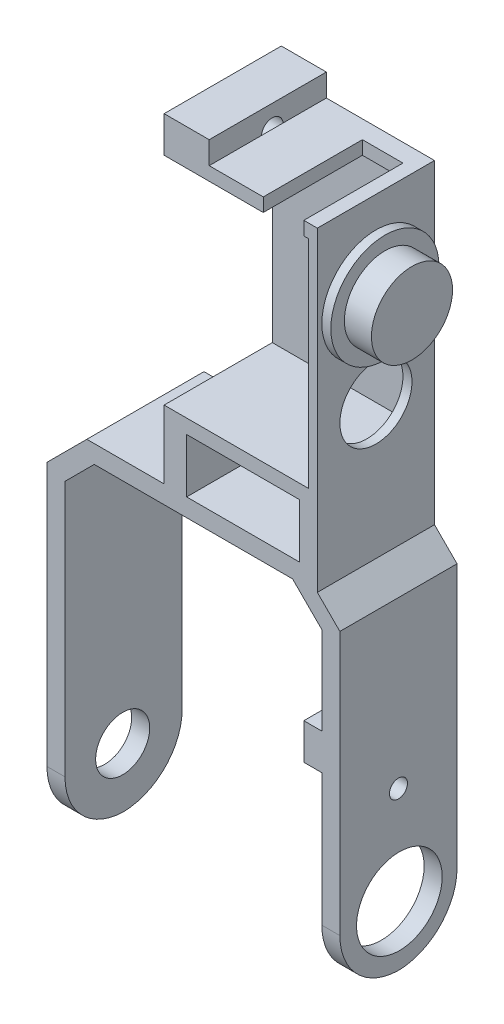
from build123d import *

# Parameters (mm, degrees)
BOSS_EXTRUDE1_DEPTH = 65
BOSS_EXTRUDE2_DEPTH = 65
SKETCH3_W           = 62.5
SKETCH3_H           = 30
CUT_EXTRUDE1_DEPTH  = 65
SKETCH5_W           = 80
SKETCH5_H           = 120
CUT_EXTRUDE2_DEPTH  = 60
SKETCH6_R           = 6
CUT_EXTRUDE3_DEPTH  = 25
FILLET1_R           = 33
SKETCH7_R           = 15
CUT_EXTRUDE4_DEPTH  = 10
SKETCH8_R           = 23.75
CUT_EXTRUDE5_DEPTH  = 10
SKETCH10_W          = 22.5
SKETCH10_H          = 55
CUT_EXTRUDE7_DEPTH  = 25
SKETCH11_R          = 20
CUT_EXTRUDE8_DEPTH  = 5
SKETCH12_R          = 30
BOSS_EXTRUDE3_DEPTH = 5
SKETCH13_R          = 22.5
BOSS_EXTRUDE4_DEPTH = 15
SKETCH14_W          = 10
SKETCH14_H          = 20
BOSS_EXTRUDE5_DEPTH = 65
SKETCH15_R          = 5
CUT_EXTRUDE9_DEPTH  = 10


with BuildPart() as part:
    # Sketch1 → Boss-Extrude1 (new body)
    with BuildSketch(Plane.XY):
        Polygon((-59.142135624, 0), (59.142135624, 0), (81.25, -22.107864376), (81.25, -201.25), (71.25, -201.25), (71.25, -26.25), (55, -10), (-55, -10), (-71.25, -26.25), (-71.25, -201.25), (-81.25, -201.25), (-81.25, -22.107864376), align=None)
    extrude(amount=BOSS_EXTRUDE1_DEPTH)

    # Sketch2 → Boss-Extrude2 (add)
    with BuildSketch(Plane.XY):
        Polygon((68.75, -9.607864376), (68.75, 165.392135624), (8.75, 165.392135624), (8.75, 177.892135624), (-16.25, 177.892135624), (-16.25, 0), (59.142135624, 0), align=None)
    extrude(amount=BOSS_EXTRUDE2_DEPTH)

    # Sketch3 → Cut-Extrude1 (cut)
    with BuildSketch(Plane.XY.offset(65)):
        with Locations((27.5, 15)):
            Rectangle(SKETCH3_W, SKETCH3_H)
    extrude(amount=-CUT_EXTRUDE1_DEPTH, mode=Mode.SUBTRACT)

    # Sketch5 → Cut-Extrude2 (cut)
    with BuildSketch(Plane.XY.offset(65)):
        with Locations((23.75, 97.892135624)):
            Rectangle(SKETCH5_W, SKETCH5_H)
    extrude(amount=-CUT_EXTRUDE2_DEPTH, mode=Mode.SUBTRACT)

    # Sketch6 → Cut-Extrude3 (cut)
    with BuildSketch(Plane.ZY.offset(16.25)):
        with Locations(Location((30, 164.892135624, 0), (0, 0, 270))):
            Circle(SKETCH6_R)
        with Locations(Location((30, 29.942135624, 0), (0, 0, 179.447427343))):
            Circle(SKETCH6_R)
    extrude(amount=-CUT_EXTRUDE3_DEPTH, mode=Mode.SUBTRACT)

    # Fillet1
    # the kernel refuses this fillet: 33 mm, written as the material it takes off along each edge
    with BuildSketch(Plane(origin=(163.75, -201.25, 65), x_dir=(0, 1, 0), z_dir=(-1, 0, 0)), Plane(origin=(11.25, -201.25, 65), x_dir=(0, 1, 0), z_dir=(-1, 0, 0))) as fillet1_piece_1:
        with BuildLine():
            CenterArc((FILLET1_R, FILLET1_R), FILLET1_R, 180, 90)
            Line((0, FILLET1_R), (0, 0))
            Line((0, 0), (FILLET1_R, 0))
        make_face()
    extrude(amount=175, mode=Mode.SUBTRACT)
    with BuildSketch(Plane(origin=(163.75, -201.25, 0), x_dir=(0, 1, 0), z_dir=(-1, 0, 0)), Plane(origin=(11.25, -201.25, 0), x_dir=(0, 1, 0), z_dir=(-1, 0, 0))) as fillet1_piece_2:
        with BuildLine():
            CenterArc((FILLET1_R, -FILLET1_R), FILLET1_R, 90, 90)
            Line((0, -FILLET1_R), (0, 0))
            Line((0, 0), (FILLET1_R, 0))
        make_face()
    extrude(amount=175, mode=Mode.SUBTRACT)

    # Sketch7 → Cut-Extrude4 (cut)
    with BuildSketch(Plane.ZY.offset(81.25)):
        with Locations((33, -168.25)):
            Circle(SKETCH7_R)
    extrude(amount=-CUT_EXTRUDE4_DEPTH, mode=Mode.SUBTRACT)

    # Sketch8 → Cut-Extrude5 (cut)
    with BuildSketch(Plane(origin=(81.25, 0, 0), x_dir=(0, 0, -1), z_dir=(1, 0, 0))):
        with Locations((-32, -168.25)):
            Circle(SKETCH8_R)
    extrude(amount=-CUT_EXTRUDE5_DEPTH, mode=Mode.SUBTRACT)

    # Sketch10 → Cut-Extrude7 (cut)
    with BuildSketch(Plane(origin=(0, 165.392135624, 0), x_dir=(1, 0, 0), z_dir=(0, 1, 0))):
        with Locations((50, -37.5)):
            Rectangle(SKETCH10_W, SKETCH10_H)
    extrude(amount=-CUT_EXTRUDE7_DEPTH, mode=Mode.SUBTRACT)

    # Sketch11 → Cut-Extrude8 (cut)
    with BuildSketch(Plane(origin=(68.75, 0, 0), x_dir=(0, 0, -1), z_dir=(1, 0, 0))):
        with Locations((-32.5, 65.392135624)):
            Circle(SKETCH11_R)
    extrude(amount=-CUT_EXTRUDE8_DEPTH, mode=Mode.SUBTRACT)

    # Sketch12 → Boss-Extrude3 (add)
    with BuildSketch(Plane(origin=(68.75, 0, 0), x_dir=(0, 0, -1), z_dir=(1, 0, 0))):
        with Locations(Location((-32.5, 118.286013704, 0), (0, 0, 180))):
            Circle(SKETCH12_R)
    extrude(amount=BOSS_EXTRUDE3_DEPTH)

    # Sketch13 → Boss-Extrude4 (add)
    with BuildSketch(Plane(origin=(73.75, 0, 0), x_dir=(0, 0, -1), z_dir=(1, 0, 0))):
        with Locations((-32.5, 118.286013704)):
            Circle(SKETCH13_R)
    extrude(amount=BOSS_EXTRUDE4_DEPTH)

    # Sketch14 → Boss-Extrude5 (add)
    with BuildSketch(Plane.XY):
        with Locations((66.25, -85)):
            Rectangle(SKETCH14_W, SKETCH14_H)
    extrude(amount=BOSS_EXTRUDE5_DEPTH)

    # Sketch15 → Cut-Extrude9 (cut)
    with BuildSketch(Plane(origin=(81.25, 0, 0), x_dir=(0, 0, -1), z_dir=(1, 0, 0))):
        with Locations((-32.5, -113.83)):
            Circle(SKETCH15_R)
    extrude(amount=-CUT_EXTRUDE9_DEPTH, mode=Mode.SUBTRACT)


solid = part.part
